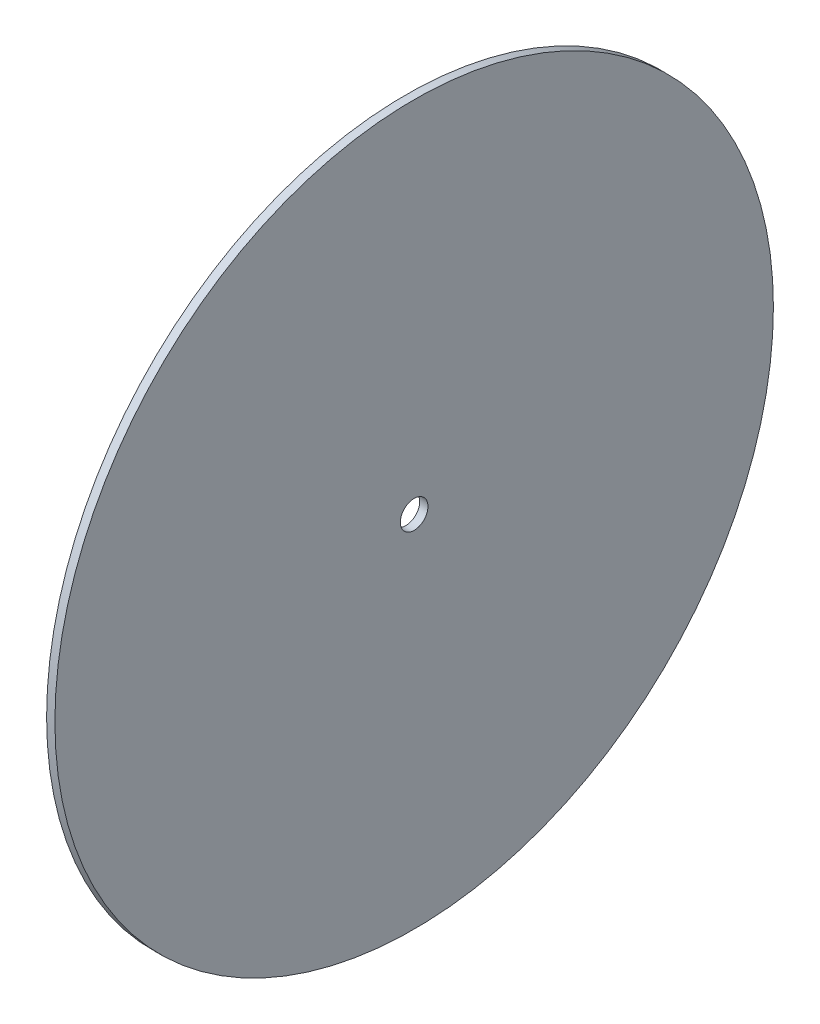
from build123d import *

# Parameters (mm, degrees)
SKETCH1_R           = 130
SKETCH1_R_2         = 5
BOSS_EXTRUDE1_DEPTH = 3


with BuildPart() as part:
    # Sketch1 → Boss-Extrude1 (new body)
    with BuildSketch(Plane(origin=(0, 0, 0), x_dir=(0, 0, -1), z_dir=(1, 0, 0))):
        Circle(SKETCH1_R)
        Circle(SKETCH1_R_2, mode=Mode.SUBTRACT)
    extrude(amount=BOSS_EXTRUDE1_DEPTH)


solid = part.part
